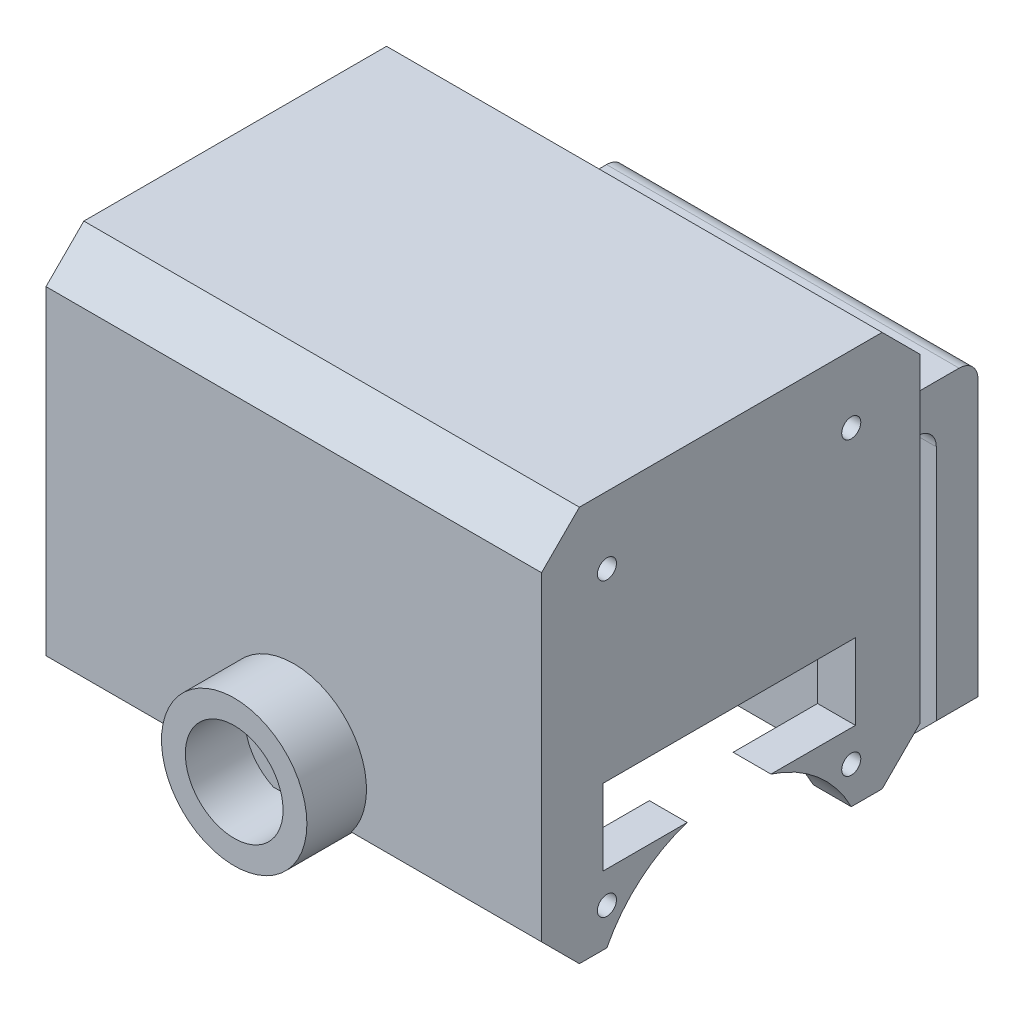
from build123d import *

# Parameters (mm, degrees)
SKETCH1_W                       = 25
SKETCH1_H                       = 30
BOSS_EXTRUDE1_DEPTH             = 3.175
SKETCH2_W                       = 25
SKETCH2_H                       = 3.175
BOSS_EXTRUDE2_DEPTH             = 41.58
SKETCH3_W                       = 3.175
SKETCH3_H                       = 25
BOSS_EXTRUDE3_DEPTH             = 30
CUT_EXTRUDE1_REACH              = 60.775
SKETCH4_R                       = 11.5
CUT_EXTRUDE2_REACH              = 60.775
SKETCH5_R                       = 0.8
CUT_EXTRUDE3_REACH              = 60.775
SKETCH6_R                       = 0.8
SKETCH6_R_2                     = 0.799851166
SKETCH6_W                       = 21.2
SKETCH6_H                       = 6.375
CUT_EXTRUDE4_REACH              = 60.775
SKETCH7_R                       = 11.5
BOSS_EXTRUDE4_DEPTH             = 0.2
SKETCH9_W                       = 41.58
SKETCH9_H                       = 33.175
BOSS_EXTRUDE5_DEPTH             = 3.175
BOSS_EXTRUDE6_DEPTH             = 0.2
SKETCH11_W                      = 41.58
SKETCH11_H                      = 33.175
BOSS_EXTRUDE7_DEPTH             = 3.175
CHAMFER1_SIZE                   = 3.175
CHAMFER2_SIZE                   = 3.175
SKETCH13_W                      = 29.58
SKETCH13_H                      = 3.175
BOSS_EXTRUDE8_DEPTH             = 7.695
BOSS_EXTRUDE9_REACH             = 59.968
SKETCH14_W                      = 29.58
SKETCH14_H                      = 3.5
BOSS_EXTRUDE9_DIRECTION_2_DEPTH = 25
CHAMFER3_SIZE                   = 3.5
FILLET1_R                       = 1.5875
FILLET2_R                       = 1.5875
CUT_EXTRUDE5_REACH              = 70.161
SKETCH16_R                      = 6.1
SKETCH20_R                      = 8
SKETCH20_R_2                    = 4.1
BOSS_EXTRUDE11_DEPTH            = 5
CUT_EXTRUDE6_START              = -21.7275
SKETCH21_R                      = 1.025
CUT_EXTRUDE6_DEPTH              = 16
BOSS_EXTRUDE12_DEPTH            = 5
BOSS_EXTRUDE12_DEPTH_BACK       = 1.2
SKETCH23_R                      = 6.1
SKETCH23_R_2                    = 4.1
CHAMFER4_SIZE                   = 1.5


with BuildPart() as part:
    # Sketch1 → Boss-Extrude1 (new body)
    with BuildSketch(Plane(origin=(0, 0, 0), x_dir=(0, 0, -1), z_dir=(1, 0, 0))):
        with Locations((12.5, 15)):
            Rectangle(SKETCH1_W, SKETCH1_H)
    extrude(amount=BOSS_EXTRUDE1_DEPTH)

    # Sketch2 → Boss-Extrude2 (add)
    with BuildSketch(Plane.ZY):
        with Locations((-12.5, 31.5875)):
            Rectangle(SKETCH2_W, SKETCH2_H)
    extrude(amount=-BOSS_EXTRUDE2_DEPTH)

    # Sketch3 → Boss-Extrude3 (add)
    with BuildSketch(Plane.XZ.offset(-30)):
        with Locations((39.9925, -12.5)):
            Rectangle(SKETCH3_W, SKETCH3_H)
    extrude(amount=BOSS_EXTRUDE3_DEPTH)

    # Sketch4 → Cut-Extrude1 (cut, up to next)
    with BuildSketch(Plane.ZY, mode=Mode.PRIVATE) as cut_extrude1_sk1:
        with Locations((-12.359999929, -5.209996254)):
            Circle(SKETCH4_R)
    cut_extrude1_tool1 = extrude(cut_extrude1_sk1.sketch, amount=-CUT_EXTRUDE1_REACH, mode=Mode.PRIVATE) & part.part
    add(cut_extrude1_tool1.solids().sort_by_distance((0, -5.209996, -12.36))[0], mode=Mode.SUBTRACT)

    # Sketch5 → Cut-Extrude2 (cut, up to next)
    with BuildSketch(Plane.ZY, mode=Mode.PRIVATE) as cut_extrude2_sk1:
        with Locations((-22.609999929, 3.090003746)):
            Circle(SKETCH5_R)
    cut_extrude2_tool1 = extrude(cut_extrude2_sk1.sketch, amount=-CUT_EXTRUDE2_REACH, mode=Mode.PRIVATE) & part.part
    # Sketch5 → Cut-Extrude2 (cut, up to next)
    with BuildSketch(Plane.ZY, mode=Mode.PRIVATE) as cut_extrude2_sk2:
        with Locations((-22.609999929, 23.790003746)):
            Circle(SKETCH5_R)
    cut_extrude2_tool2 = extrude(cut_extrude2_sk2.sketch, amount=-CUT_EXTRUDE2_REACH, mode=Mode.PRIVATE) & part.part
    # Sketch5 → Cut-Extrude2 (cut, up to next)
    with BuildSketch(Plane.ZY, mode=Mode.PRIVATE) as cut_extrude2_sk3:
        with Locations((-2.109999929, 23.790003746)):
            Circle(SKETCH5_R)
    cut_extrude2_tool3 = extrude(cut_extrude2_sk3.sketch, amount=-CUT_EXTRUDE2_REACH, mode=Mode.PRIVATE) & part.part
    # Sketch5 → Cut-Extrude2 (cut, up to next)
    with BuildSketch(Plane.ZY, mode=Mode.PRIVATE) as cut_extrude2_sk4:
        with Locations((-2.109999929, 3.090003746)):
            Circle(SKETCH5_R)
    cut_extrude2_tool4 = extrude(cut_extrude2_sk4.sketch, amount=-CUT_EXTRUDE2_REACH, mode=Mode.PRIVATE) & part.part
    add(cut_extrude2_tool1.solids().sort_by_distance((0, 3.090004, -22.61))[0], mode=Mode.SUBTRACT)
    add(cut_extrude2_tool2.solids().sort_by_distance((0, 23.790004, -22.61))[0], mode=Mode.SUBTRACT)
    add(cut_extrude2_tool3.solids().sort_by_distance((0, 23.790004, -2.11))[0], mode=Mode.SUBTRACT)
    add(cut_extrude2_tool4.solids().sort_by_distance((0, 3.090004, -2.11))[0], mode=Mode.SUBTRACT)

    # Sketch6 → Cut-Extrude3 (cut, up to next)
    with BuildSketch(Plane(origin=(41.58, 0, 0), x_dir=(0, 0, -1), z_dir=(1, 0, 0)), mode=Mode.PRIVATE) as cut_extrude3_sk1:
        with Locations(Location((2.109999929, 3.090003746, 0), (0, 0, 180))):
            Circle(SKETCH6_R)
    cut_extrude3_tool1 = extrude(cut_extrude3_sk1.sketch, amount=-CUT_EXTRUDE3_REACH, mode=Mode.PRIVATE) & part.part
    # Sketch6 → Cut-Extrude3 (cut, up to next)
    with BuildSketch(Plane(origin=(41.58, 0, 0), x_dir=(0, 0, -1), z_dir=(1, 0, 0)), mode=Mode.PRIVATE) as cut_extrude3_sk2:
        with Locations(Location((22.609999929, 3.090003746, 0), (0, 0, 180))):
            Circle(SKETCH6_R)
    cut_extrude3_tool2 = extrude(cut_extrude3_sk2.sketch, amount=-CUT_EXTRUDE3_REACH, mode=Mode.PRIVATE) & part.part
    # Sketch6 → Cut-Extrude3 (cut, up to next)
    with BuildSketch(Plane(origin=(41.58, 0, 0), x_dir=(0, 0, -1), z_dir=(1, 0, 0)), mode=Mode.PRIVATE) as cut_extrude3_sk3:
        with Locations((22.609999929, 27.540003746)):
            Circle(SKETCH6_R_2)
    cut_extrude3_tool3 = extrude(cut_extrude3_sk3.sketch, amount=-CUT_EXTRUDE3_REACH, mode=Mode.PRIVATE) & part.part
    # Sketch6 → Cut-Extrude3 (cut, up to next)
    with BuildSketch(Plane(origin=(41.58, 0, 0), x_dir=(0, 0, -1), z_dir=(1, 0, 0)), mode=Mode.PRIVATE) as cut_extrude3_sk4:
        with Locations((2.109999929, 27.540003746)):
            Circle(SKETCH6_R)
    cut_extrude3_tool4 = extrude(cut_extrude3_sk4.sketch, amount=-CUT_EXTRUDE3_REACH, mode=Mode.PRIVATE) & part.part
    # Sketch6 → Cut-Extrude3 (cut, up to next)
    with BuildSketch(Plane(origin=(41.58, 0, 0), x_dir=(0, 0, -1), z_dir=(1, 0, 0)), mode=Mode.PRIVATE) as cut_extrude3_sk5:
        with Locations((12.359999929, 8.927503746)):
            Rectangle(SKETCH6_W, SKETCH6_H)
    cut_extrude3_tool5 = extrude(cut_extrude3_sk5.sketch, amount=-CUT_EXTRUDE3_REACH, mode=Mode.PRIVATE) & part.part
    add(cut_extrude3_tool1.solids().sort_by_distance((41.58, 3.090004, -2.11))[0], mode=Mode.SUBTRACT)
    add(cut_extrude3_tool2.solids().sort_by_distance((41.58, 3.090004, -22.61))[0], mode=Mode.SUBTRACT)
    add(cut_extrude3_tool3.solids().sort_by_distance((41.58, 27.540004, -22.61))[0], mode=Mode.SUBTRACT)
    add(cut_extrude3_tool4.solids().sort_by_distance((41.58, 27.540004, -2.11))[0], mode=Mode.SUBTRACT)
    add(cut_extrude3_tool5.solids().sort_by_distance((41.58, 8.927504, -12.36))[0], mode=Mode.SUBTRACT)

    # Sketch7 → Cut-Extrude4 (cut, up to next)
    with BuildSketch(Plane(origin=(41.58, 0, 0), x_dir=(0, 0, -1), z_dir=(1, 0, 0)), mode=Mode.PRIVATE) as cut_extrude4_sk1:
        with Locations((12.359999929, -5.209996254)):
            Circle(SKETCH7_R)
    cut_extrude4_tool1 = extrude(cut_extrude4_sk1.sketch, amount=-CUT_EXTRUDE4_REACH, mode=Mode.PRIVATE) & part.part
    add(cut_extrude4_tool1.solids().sort_by_distance((41.58, -5.209996, -12.36))[0], mode=Mode.SUBTRACT)

    # Sketch8 → Boss-Extrude4 (add)
    with BuildSketch(Plane.XY):
        Polygon((0, 33.175), (0, 0), (3.175, 0), (3.175, 30), (38.405, 30), (38.405, 0), (41.58, 0), (41.58, 33.175), align=None)
    extrude(amount=BOSS_EXTRUDE4_DEPTH)

    # Sketch9 → Boss-Extrude5 (add)
    with BuildSketch(Plane.XY.offset(0.2)):
        with Locations((20.79, 16.5875)):
            Rectangle(SKETCH9_W, SKETCH9_H)
    extrude(amount=BOSS_EXTRUDE5_DEPTH)

    # Sketch10 → Boss-Extrude6 (add)
    with BuildSketch(Plane(origin=(0, 0, -25), x_dir=(-1, 0, 0), z_dir=(0, 0, -1))):
        Polygon((0, 0), (0, 33.175), (-41.58, 33.175), (-41.58, 0), (-38.405, 0), (-38.405, 30), (-3.175, 30), (-3.175, 0), align=None)
    extrude(amount=BOSS_EXTRUDE6_DEPTH)

    # Sketch11 → Boss-Extrude7 (add)
    with BuildSketch(Plane(origin=(0, 0, -25.2), x_dir=(-1, 0, 0), z_dir=(0, 0, -1))):
        with Locations((-20.79, 16.5875)):
            Rectangle(SKETCH11_W, SKETCH11_H)
    extrude(amount=BOSS_EXTRUDE7_DEPTH)

    # Chamfer1
    chamfer1_edges = [part.edges().sort_by_distance(p)[0] for p in [
        (20.79, 33.175, 3.375),
        (20.79, 33.175, -28.375),
    ]]
    chamfer(chamfer1_edges, length=CHAMFER1_SIZE)

    # Chamfer2
    chamfer2_edges = [part.edges().sort_by_distance(p)[0] for p in [
        (20.79, 0, 3.375),
        (20.79, 0, -28.375),
    ]]
    chamfer(chamfer2_edges, length=CHAMFER2_SIZE - 0.0001)  # a hair under: the kernel refuses the full size

    # Sketch13 → Boss-Extrude8 (add)
    with BuildSketch(Plane(origin=(0, 0, -28.375), x_dir=(-1, 0, 0), z_dir=(0, 0, -1))):
        with Locations((-20.79, 19.7625)):
            Rectangle(SKETCH13_W, SKETCH13_H)
    extrude(amount=BOSS_EXTRUDE8_DEPTH)

    # Boss-Extrude9: up to this face of the body (flat: up to its plane)
    boss_extrude9_end = Plane(part.part.faces().sort_by_distance((20.79, 21.35, -32.2225))[0])
    # Sketch14 → Boss-Extrude9 (add, up to the picked face)
    with BuildSketch(Plane.XZ.offset(-18.175), mode=Mode.PRIVATE) as boss_extrude9_sk1:
        with Locations((20.79, -37.495)):
            Rectangle(SKETCH14_W, SKETCH14_H)
    boss_extrude9_tool1 = split(extrude(boss_extrude9_sk1.sketch, amount=-BOSS_EXTRUDE9_REACH, mode=Mode.PRIVATE), bisect_by=boss_extrude9_end, keep=Keep.BOTH, mode=Mode.PRIVATE)
    add(boss_extrude9_tool1.solids().sort_by(Axis((20.79, 18.175, -37.495), (0, 1, 0)))[0])

    # Sketch14 → Boss-Extrude9 direction 2 (add)
    with BuildSketch(Plane.XZ.offset(-18.175)):
        with Locations((20.79, -37.495)):
            Rectangle(SKETCH14_W, SKETCH14_H)
    extrude(amount=BOSS_EXTRUDE9_DIRECTION_2_DEPTH)

    # Chamfer3
    chamfer3_edges = [part.edges().sort_by_distance(p)[0] for p in [
        (6, -6.825, -37.495),
        (35.58, -6.825, -37.495),
    ]]
    chamfer(chamfer3_edges, length=CHAMFER3_SIZE)

    # Fillet1
    fillet1_edges = [part.edges().sort_by_distance(p)[0] for p in [
        (20.79, 18.175, -35.745),
        (20.79, 21.35, -39.245),
    ]]
    fillet(fillet1_edges, radius=FILLET1_R)

    # Fillet2
    fillet2_edges = [part.edges().sort_by_distance(p)[0] for p in [
        (20.79, 21.35, -28.375),
    ]]
    fillet(fillet2_edges, radius=FILLET2_R)

    # Sketch16 → Cut-Extrude5 (cut, up to next)
    with BuildSketch(Plane(origin=(0, 0, -39.245), x_dir=(-1, 0, 0), z_dir=(0, 0, -1)), mode=Mode.PRIVATE) as cut_extrude5_sk1:
        with Locations((-20.79, 6.9025)):
            Circle(SKETCH16_R)
    cut_extrude5_tool1 = extrude(cut_extrude5_sk1.sketch, amount=-CUT_EXTRUDE5_REACH, mode=Mode.PRIVATE) & part.part
    add(cut_extrude5_tool1.solids().sort_by_distance((20.79, 6.9025, -39.245))[0], mode=Mode.SUBTRACT)

    # Sketch20 → Boss-Extrude11 (add)
    with BuildSketch(Plane.XY.offset(-35.745)):
        with Locations(Location((20.79, 6.9025, 0), (0, 0, 180))):
            Circle(SKETCH20_R)
        with Locations((20.79, 6.9025)):
            Circle(SKETCH20_R_2, mode=Mode.SUBTRACT)
    extrude(amount=BOSS_EXTRUDE11_DEPTH)

    # Sketch21 → Cut-Extrude6 (cut)
    with BuildSketch(Plane.XZ.offset(6.825).offset(CUT_EXTRUDE6_START)):
        with Locations(Location((20.79, -33.245, 0), (0, 0, 270))):
            Circle(SKETCH21_R)
    extrude(amount=CUT_EXTRUDE6_DEPTH, mode=Mode.SUBTRACT)

    # Sketch23 → Boss-Extrude12 (add, two sides: drawn at the far end of the back side and taken through both)
    with BuildSketch(Plane.XY.offset(3.375).offset(-BOSS_EXTRUDE12_DEPTH_BACK)):
        with Locations(Location((20.79, 6.9025, 0), (0, 0, 180))):
            Circle(SKETCH23_R)
        with Locations((20.79, 6.9025)):
            Circle(SKETCH23_R_2, mode=Mode.SUBTRACT)
    extrude(amount=BOSS_EXTRUDE12_DEPTH + BOSS_EXTRUDE12_DEPTH_BACK)

    # Chamfer4
    chamfer4_edges = [part.edges().sort_by_distance(p)[0] for p in [
        (35.58, 20.55625, -28.375),
        (20.79, 18.175, -28.375),
        (6, 20.55625, -28.375),
    ]]
    chamfer(chamfer4_edges, length=CHAMFER4_SIZE)


solid = part.part
